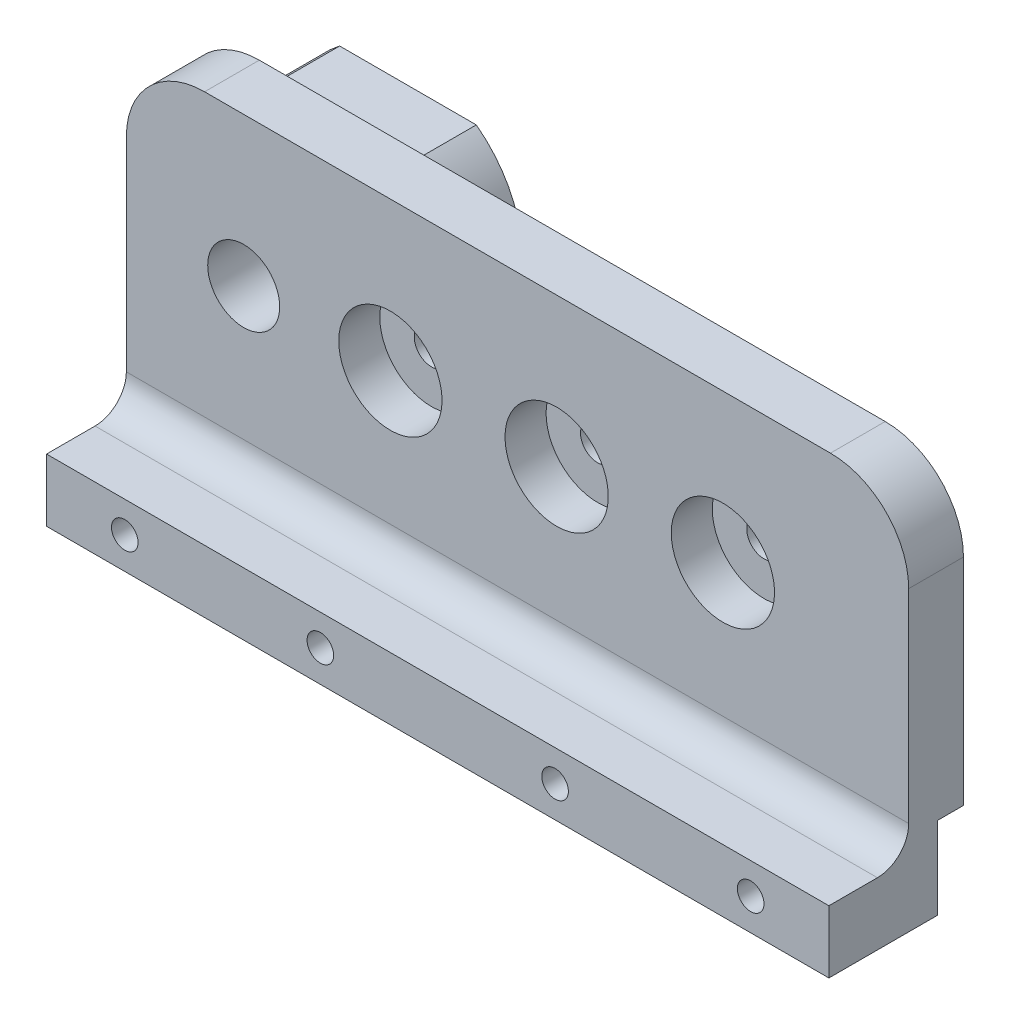
from build123d import *

# Parameters (mm, degrees)
SKETCH1_W           = 100
SKETCH1_H           = 48
BOSS_EXTRUDE1_DEPTH = 7
CUT_EXTRUDE1_REACH  = 113.144
SKETCH2_R           = 4.6
SKETCH2_R_2         = 2.2
SKETCH3_W           = 100
SKETCH3_H           = 8
BOSS_EXTRUDE2_DEPTH = 10.2
SKETCH4_R           = 6.6
CUT_EXTRUDE2_DEPTH  = 5.25
SKETCH5_R           = 2.6
CUT_EXTRUDE3_DEPTH  = 0.1
SKETCH7_R           = 1.7
CUT_EXTRUDE4_DEPTH  = 113.233729333
CUT_EXTRUDE5_REACH  = 114.249
SKETCH8_R           = 1.7
CUT_EXTRUDE6_REACH  = 116.257
SKETCH9_W           = 3.3
SKETCH9_H           = 10.5
BOSS_EXTRUDE3_DEPTH = 14
SHELL1_T            = 2.5
FILLET3_R           = 10
CUT_EXTRUDE7_START  = -3
CUT_EXTRUDE7_DEPTH  = 3.2
CUT_EXTRUDE8_DEPTH  = 5
FILLET4_R           = 4


with BuildPart() as part:
    # Sketch1 → Boss-Extrude1 (new body)
    with BuildSketch(Plane.XY):
        with Locations((50, 24)):
            Rectangle(SKETCH1_W, SKETCH1_H)
    extrude(amount=BOSS_EXTRUDE1_DEPTH)

    # Sketch2 → Cut-Extrude1 (cut, up to next)
    with BuildSketch(Plane.XY.offset(7), mode=Mode.PRIVATE) as cut_extrude1_sk1:
        with Locations((15, 29)):
            Circle(SKETCH2_R)
    cut_extrude1_tool1 = extrude(cut_extrude1_sk1.sketch, amount=-CUT_EXTRUDE1_REACH, mode=Mode.PRIVATE) & part.part
    # Sketch2 → Cut-Extrude1 (cut, up to next)
    with BuildSketch(Plane.XY.offset(7), mode=Mode.PRIVATE) as cut_extrude1_sk2:
        with Locations((33.75, 29)):
            Circle(SKETCH2_R_2)
    cut_extrude1_tool2 = extrude(cut_extrude1_sk2.sketch, amount=-CUT_EXTRUDE1_REACH, mode=Mode.PRIVATE) & part.part
    # Sketch2 → Cut-Extrude1 (cut, up to next)
    with BuildSketch(Plane.XY.offset(7), mode=Mode.PRIVATE) as cut_extrude1_sk3:
        with Locations((55, 29)):
            Circle(SKETCH2_R_2)
    cut_extrude1_tool3 = extrude(cut_extrude1_sk3.sketch, amount=-CUT_EXTRUDE1_REACH, mode=Mode.PRIVATE) & part.part
    # Sketch2 → Cut-Extrude1 (cut, up to next)
    with BuildSketch(Plane.XY.offset(7), mode=Mode.PRIVATE) as cut_extrude1_sk4:
        with Locations((76.25, 29)):
            Circle(SKETCH2_R_2)
    cut_extrude1_tool4 = extrude(cut_extrude1_sk4.sketch, amount=-CUT_EXTRUDE1_REACH, mode=Mode.PRIVATE) & part.part
    add(cut_extrude1_tool1.solids().sort_by_distance((15, 29, 7))[0], mode=Mode.SUBTRACT)
    add(cut_extrude1_tool2.solids().sort_by_distance((33.75, 29, 7))[0], mode=Mode.SUBTRACT)
    add(cut_extrude1_tool3.solids().sort_by_distance((55, 29, 7))[0], mode=Mode.SUBTRACT)
    add(cut_extrude1_tool4.solids().sort_by_distance((76.25, 29, 7))[0], mode=Mode.SUBTRACT)

    # Sketch3 → Boss-Extrude2 (add)
    with BuildSketch(Plane(origin=(0, 0, 0), x_dir=(-1, 0, 0), z_dir=(0, 0, -1))):
        with Locations((-50, 4)):
            Rectangle(SKETCH3_W, SKETCH3_H)
    extrude(amount=BOSS_EXTRUDE2_DEPTH)

    # Sketch4 → Cut-Extrude2 (cut)
    with BuildSketch(Plane(origin=(0, 0, 0), x_dir=(-1, 0, 0), z_dir=(0, 0, -1))):
        with Locations((-76.25, 29)):
            Circle(SKETCH4_R)
        with Locations((-55, 29)):
            Circle(SKETCH4_R)
        with Locations((-33.75, 29)):
            Circle(SKETCH4_R)
    extrude(amount=-CUT_EXTRUDE2_DEPTH, mode=Mode.SUBTRACT)

    # Sketch5 → Cut-Extrude3 (cut)
    with BuildSketch(Plane.XY.offset(7)):
        with Locations((35.000022648, 4.052132501)):
            Circle(SKETCH5_R)
        with Locations((64.999977352, 4)):
            Circle(SKETCH5_R)
    extrude(amount=-CUT_EXTRUDE3_DEPTH, mode=Mode.SUBTRACT)

    # Sketch7 → Cut-Extrude4 (cut, through all)
    with BuildSketch(Plane.XY.offset(6.9)):
        with Locations((35.000022648, 4.052132501)):
            Circle(SKETCH7_R)
        with Locations((64.999977352, 4)):
            Circle(SKETCH7_R)
    extrude(amount=-CUT_EXTRUDE4_DEPTH, mode=Mode.SUBTRACT)

    # Sketch8 → Cut-Extrude5 (cut, up to next)
    with BuildSketch(Plane.XY.offset(7), mode=Mode.PRIVATE) as cut_extrude5_sk1:
        with Locations((10, 4.052132501)):
            Circle(SKETCH8_R)
    cut_extrude5_tool1 = extrude(cut_extrude5_sk1.sketch, amount=-CUT_EXTRUDE5_REACH, mode=Mode.PRIVATE) & part.part
    # Sketch8 → Cut-Extrude5 (cut, up to next)
    with BuildSketch(Plane.XY.offset(7), mode=Mode.PRIVATE) as cut_extrude5_sk2:
        with Locations((90, 4.052132501)):
            Circle(SKETCH8_R)
    cut_extrude5_tool2 = extrude(cut_extrude5_sk2.sketch, amount=-CUT_EXTRUDE5_REACH, mode=Mode.PRIVATE) & part.part
    add(cut_extrude5_tool1.solids().sort_by_distance((10, 4.052133, 7))[0], mode=Mode.SUBTRACT)
    add(cut_extrude5_tool2.solids().sort_by_distance((90, 4.052133, 7))[0], mode=Mode.SUBTRACT)


with BuildPart() as body_2:
    # Mirror1: mirrored copy
    add(part.part.mirror(Plane.XY.offset(-10.2)))

    # Sketch9 → Cut-Extrude6 (cut, up to next)
    with BuildSketch(Plane(origin=(100, 0, 0), x_dir=(0, 0, -1), z_dir=(1, 0, 0)), mode=Mode.PRIVATE) as cut_extrude6_sk1:
        with Locations((25.75, 5.25)):
            Rectangle(SKETCH9_W, SKETCH9_H)
    cut_extrude6_tool1 = extrude(cut_extrude6_sk1.sketch, amount=-CUT_EXTRUDE6_REACH, mode=Mode.PRIVATE) & body_2.part
    add(cut_extrude6_tool1.solids().sort_by_distance((100, 5.25, -25.75))[0], mode=Mode.SUBTRACT)


with BuildPart() as body_2_2:
    # Sketch10 → Boss-Extrude3 (new body)
    with BuildSketch(Plane(origin=(0, 0, -27.4), x_dir=(-1, 0, 0), z_dir=(0, 0, -1))):
        with BuildLine():
            Line((-7.140610711, 38.2), (-22.859389289, 38.2))
            ThreePointArc((-22.859389289, 38.2), (-27.1, 29), (-22.859389289, 19.8))
            Line((-22.859389289, 19.8), (-7.140610711, 19.8))
            ThreePointArc((-7.140610711, 19.8), (-2.9, 29), (-7.140610711, 38.2))
        make_face()
    extrude(amount=BOSS_EXTRUDE3_DEPTH)

    # Shell1
    shell1_openings = [body_2_2.faces().sort_by_distance(p)[0] for p in [
        (15, 29, -27.4),
        (15, 29, -41.4),
    ]]
    offset(amount=SHELL1_T, openings=shell1_openings, kind=Kind.INTERSECTION)


with BuildPart() as body_2_1:
    add(body_2.part)

    # Combine1: union body 2 2
    add(body_2_2.part)

    # Fillet3
    fillet3_edges = [body_2_1.edges().sort_by_distance(p)[0] for p in [
        (0, 48, -23.9),
        (100, 48, -23.9),
    ]]
    fillet(fillet3_edges, radius=FILLET3_R)

    # Sketch11 → Cut-Extrude7 (cut)
    with BuildSketch(Plane(origin=(0, 0, -24.1), x_dir=(-1, 0, 0), z_dir=(0, 0, -1)).offset(CUT_EXTRUDE7_START)):
        Polygon((-61.65134579, 4), (-61.65134579, 0), (-68.348608913, 0), (-68.348608913, 4), (-66.674293132, 6.9), (-63.325661571, 6.9), align=None)
        Polygon((-38.288456783, 4.052132501), (-38.288456783, 0), (-31.711588514, 0), (-31.711588514, 4.052132501), (-33.355805581, 6.9), (-36.644239716, 6.9), align=None)
    extrude(amount=-CUT_EXTRUDE7_DEPTH, mode=Mode.SUBTRACT)

    # Sketch12 → Cut-Extrude8 (cut)
    with BuildSketch(Plane(origin=(0, 0, -24.1), x_dir=(-1, 0, 0), z_dir=(0, 0, -1))):
        Polygon((-88.325684219, 1.152132501), (-86.651368439, 4.052132501), (-88.325684219, 6.952132501), (-91.674315781, 6.952132501), (-93.348631561, 4.052132501), (-91.674315781, 1.152132501), align=None)
        Polygon((-8.325684219, 1.152132501), (-6.651368439, 4.052132501), (-8.325684219, 6.952132501), (-11.674315781, 6.952132501), (-13.348631561, 4.052132501), (-11.674315781, 1.152132501), align=None)
    extrude(amount=-CUT_EXTRUDE8_DEPTH, mode=Mode.SUBTRACT)

    # Fillet4
    fillet4_edges = [body_2_1.edges().sort_by_distance(p)[0] for p in [
        (50, 8, -20.4),
    ]]
    fillet(fillet4_edges, radius=FILLET4_R)


solid = body_2_1.part
